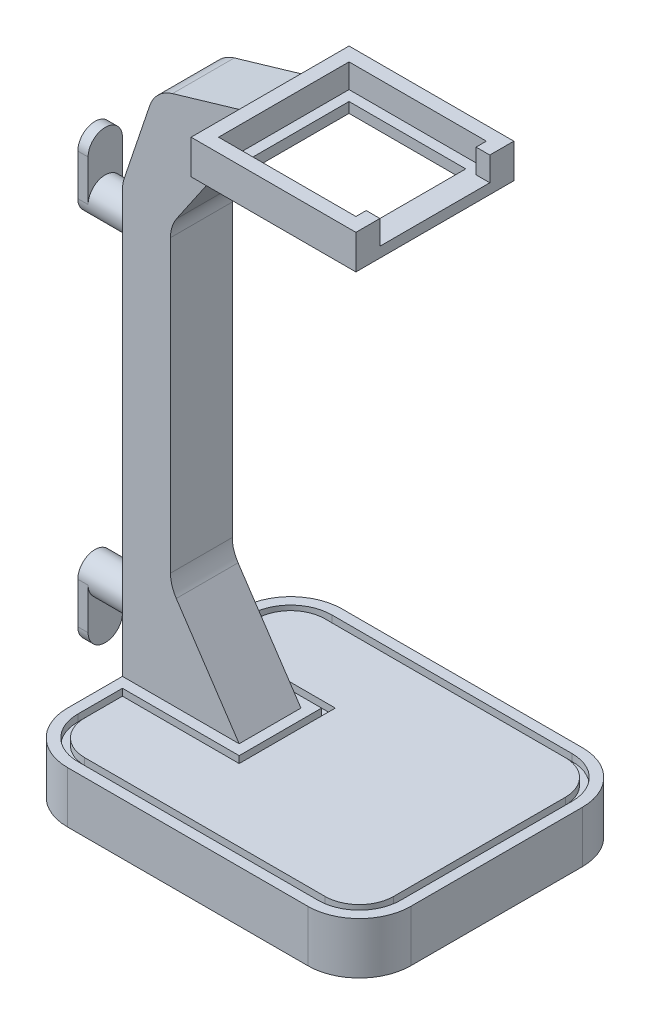
from build123d import *
from build123d.topology import SkipClean

# Parameters (mm, degrees)
BOSS_EXTRUDE1_DEPTH  = 15
SKETCH3_W            = 14
SKETCH3_H            = 18
BOSS_EXTRUDE2_DEPTH  = 150
BOSS_EXTRUDE3_DEPTH  = 18
SKETCH7_W            = 48
SKETCH7_H            = 46
SKETCH7_W_2          = 40
SKETCH7_H_2          = 38
BOSS_EXTRUDE4_DEPTH  = 10
BOSS_EXTRUDE5_DEPTH  = 18
FILLET2_R            = 10
CHAMFER2_SIZE        = 10
CHAMFER2_SIZE2       = 25.668100083
FILLET3_R            = 10
FILLET4_R            = 10
SKETCH11_W           = 40
SKETCH11_H           = 38
SKETCH11_W_2         = 34
SKETCH11_H_2         = 32
BOSS_EXTRUDE6_DEPTH  = 3
SKETCH12_W           = 32
SKETCH12_H           = 7
CUT_EXTRUDE2_DEPTH   = 5
CUT_EXTRUDE3_DEPTH   = 2
SKETCH15_R           = 5
BOSS_EXTRUDE8_DEPTH  = 14
BOSS_EXTRUDE10_DEPTH = 3


with BuildPart() as part:
    # Sketch1 → Boss-Extrude1 (new body)
    with BuildSketch(Plane(origin=(0, 0, 0), x_dir=(1, 0, 0), z_dir=(0, 1, 0))):
        with BuildLine():
            Line((35, -40), (-35, -40))
            ThreePointArc((-35, -40), (-45.606601718, -35.606601718), (-50, -25))
            Line((-50, -25), (-50, 25))
            ThreePointArc((-50, 25), (-45.606601718, 35.606601718), (-35, 40))
            Line((-35, 40), (35, 40))
            ThreePointArc((35, 40), (45.606601718, 35.606601718), (50, 25))
            Line((50, 25), (50, -25))
            ThreePointArc((50, -25), (45.606601718, -35.606601718), (35, -40))
        make_face()
    extrude(amount=BOSS_EXTRUDE1_DEPTH)

    # Sketch3 → Boss-Extrude2 (add)
    with BuildSketch(Plane(origin=(0, 15, 0), x_dir=(1, 0, 0), z_dir=(0, 1, 0))):
        with Locations((-43, 0)):
            Rectangle(SKETCH3_W, SKETCH3_H)
    extrude(amount=BOSS_EXTRUDE2_DEPTH)

    # Sketch5 → Boss-Extrude3 (add)
    with BuildSketch(Plane.XY.offset(9)):
        Polygon((-36, 15), (-36, 45), (-16, 15), align=None)
    extrude(amount=-BOSS_EXTRUDE3_DEPTH)



with BuildPart() as body_2:
    # Sketch7 → Boss-Extrude4 (new body)
    with BuildSketch(Plane(origin=(0, 175, 0), x_dir=(1, 0, 0), z_dir=(0, 1, 0))):
        with Locations((8, 0)):
            Rectangle(SKETCH7_W, SKETCH7_H)
        with Locations((8, 0)):
            Rectangle(SKETCH7_W_2, SKETCH7_H_2, mode=Mode.SUBTRACT)
    extrude(amount=-BOSS_EXTRUDE4_DEPTH)


with BuildPart() as part_1:
    add(part.part)

    add(body_2.part)  # Boss-Extrude5 merges body 2
    # Sketch8 → Boss-Extrude5 (add)
    with BuildSketch(Plane.XY.offset(9)):
        Polygon((-50, 165), (-16, 175), (-16, 165), (-36, 135.742522323), (-36, 165), align=None)
    extrude(amount=-BOSS_EXTRUDE5_DEPTH)

    # Fillet2
    # the kernel refuses this fillet: 10 mm, written as the material it adds along each edge
    with BuildSketch(Plane(origin=(-16, 165, 9), x_dir=(1, 0, 0), z_dir=(0, 0, -1))) as fillet2_piece_1:
        with BuildLine():
            CenterArc((5.338859158, 9.909967515), FILLET2_R, 214.35596202, 47.949835241)
            Line((-2.916615768, 4.266641036), (0, 0))
            Line((0, 0), (4, 0))
        make_face()
    extrude(amount=18)
    with BuildSketch(Plane(origin=(-36, 135.742522323, 9), x_dir=(0.5643326479831027, 0.825547492528673, 0), z_dir=(0, 0, -1))) as fillet2_piece_2:
        with BuildLine():
            CenterArc((FILLET2_R * 0.309130630834, FILLET2_R), FILLET2_R, 235.64403798, 34.35596202)
            Line((-FILLET2_R * 0.255202017149, FILLET2_R * 0.174452507471), (0, 0))
            Line((0, 0), (FILLET2_R * 0.309130630834, 0))
        make_face()
    extrude(amount=18)

    # Chamfer2
    chamfer2_edges = [part_1.edges().sort_by_distance(p)[0] for p in [
        (-50, 165, 0),
    ]]
    chamfer2_side = [part_1.faces().sort_by_distance(p)[0] for p in [
        (-33, 170, 0),
    ]]
    chamfer(chamfer2_edges, length=CHAMFER2_SIZE, length2=CHAMFER2_SIZE2, reference=chamfer2_side[0])

    # Fillet3
    fillet3_edges = [part_1.edges().sort_by_distance(p)[0] for p in [
        (-50, 139.331899917, 0),
        (-40.406344984, 167.82166324, 0),
    ]]
    fillet(fillet3_edges, radius=FILLET3_R)

    # Fillet4
    fillet4_edges = [part_1.edges().sort_by_distance(p)[0] for p in [
        (-36, 45, 0),
    ]]
    fillet(fillet4_edges, radius=FILLET4_R)

    # Sketch11 → Boss-Extrude6 (add)
    with BuildSketch(Plane.XZ.offset(-165)):
        with Locations((8, 0)):
            Rectangle(SKETCH11_W, SKETCH11_H)
        with Locations((8, 0)):
            Rectangle(SKETCH11_W_2, SKETCH11_H_2, mode=Mode.SUBTRACT)
    extrude(amount=-BOSS_EXTRUDE6_DEPTH)

    # Sketch12 → Cut-Extrude2 (cut)
    with BuildSketch(Plane(origin=(32, 0, 0), x_dir=(0, 0, -1), z_dir=(1, 0, 0))):
        with Locations((0, 171.5)):
            Rectangle(SKETCH12_W, SKETCH12_H)
    extrude(amount=-CUT_EXTRUDE2_DEPTH, mode=Mode.SUBTRACT)

    # Sketch13 → Cut-Extrude3 (cut)
    with BuildSketch(Plane(origin=(0, 15, 0), x_dir=(1, 0, 0), z_dir=(0, 1, 0))):
        with BuildLine():
            Line((-47, 12), (-13, 12))
            Line((-13, 12), (-13, -12))
            Line((-13, -12), (-47, -12))
            Line((-47, -12), (-47, -25))
            ThreePointArc((-47, -25), (-43.485281374, -33.485281374), (-35, -37))
            Line((-35, -37), (35, -37))
            ThreePointArc((35, -37), (43.485281374, -33.485281374), (47, -25))
            Line((47, -25), (47, 25))
            ThreePointArc((47, 25), (43.485281374, 33.485281374), (35, 37))
            Line((35, 37), (-35, 37))
            ThreePointArc((-35, 37), (-43.485281374, 33.485281374), (-47, 25))
            Line((-47, 25), (-47, 12))
        make_face()
        with BuildLine():
            Line((-45, 14), (-11, 14))
            Line((-11, 14), (-11, -14))
            Line((-11, -14), (-45, -14))
            Line((-45, -14), (-45, -25))
            ThreePointArc((-45, -25), (-42.071067812, -32.071067812), (-35, -35))
            Line((-35, -35), (35, -35))
            ThreePointArc((35, -35), (42.071067812, -32.071067812), (45, -25))
            Line((45, -25), (45, 25))
            ThreePointArc((45, 25), (42.071067812, 32.071067812), (35, 35))
            Line((35, 35), (-35, 35))
            ThreePointArc((-35, 35), (-42.071067812, 32.071067812), (-45, 25))
            Line((-45, 25), (-45, 14))
        make_face(mode=Mode.SUBTRACT)
    extrude(amount=-CUT_EXTRUDE3_DEPTH, mode=Mode.SUBTRACT)

    # Sketch15 → Boss-Extrude8 (add)
    with BuildSketch(Plane.ZY.offset(50)):
        with Locations(Location((0, 125, 0), (0, 0, 180))):
            Circle(SKETCH15_R)
        with Locations(Location((0, 29, 0), (0, 0, 180))):
            Circle(SKETCH15_R)
    extrude(amount=BOSS_EXTRUDE8_DEPTH)

    # Sketch16 → Boss-Extrude10 (add)
    with SkipClean():  # the faces are left unmerged after this step: merging them gives an invalid solid
        with BuildSketch(Plane.ZY.offset(64)):
            with BuildLine():
                Line((-5, 125), (-5, 137))
                ThreePointArc((-5, 137), (0, 142), (5, 137))
                Line((5, 137), (5, 125))
                ThreePointArc((5, 125), (0, 120), (-5, 125))
            make_face()
            with BuildLine():
                Line((-5, 17), (-5, 29))
                ThreePointArc((-5, 29), (0, 34), (5, 29))
                Line((5, 29), (5, 17))
                ThreePointArc((5, 17), (0, 12), (-5, 17))
            make_face()
        extrude(amount=BOSS_EXTRUDE10_DEPTH)
    add(part_1.part.scale(1), mode=Mode.REPLACE)  # the faces are merged on a copy


solid = part_1.part
